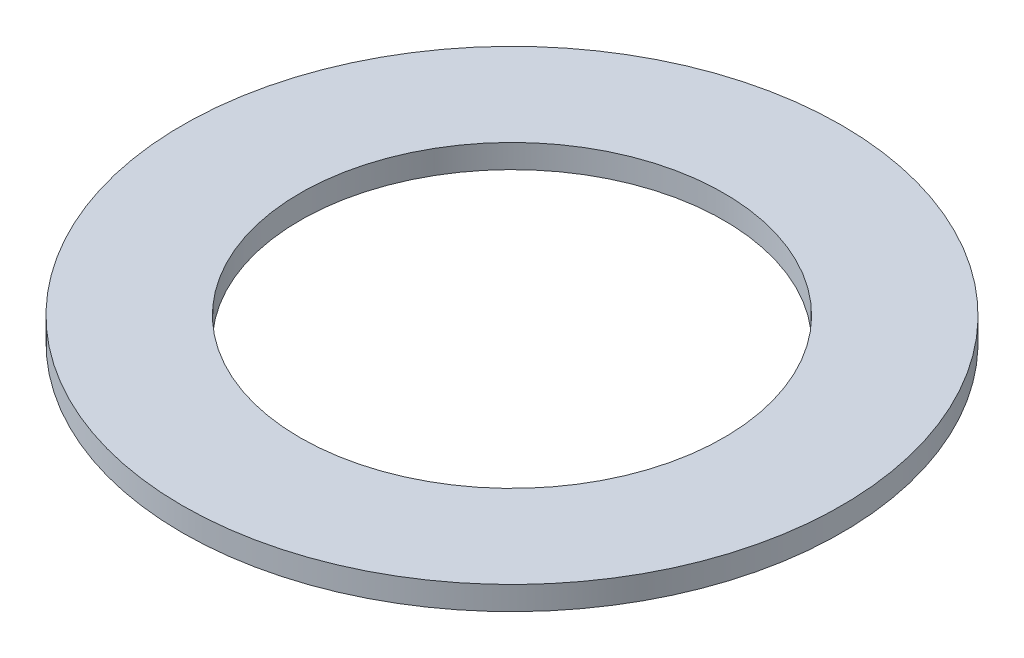
from build123d import *

# Parameters (mm, degrees)
SKETCH1_R           = 70
BOSS_EXTRUDE1_DEPTH = 5
SKETCH2_R           = 45
CUT_EXTRUDE1_DEPTH  = 100.121138008


with BuildPart() as part:
    # Sketch1 → Boss-Extrude1 (new body)
    with BuildSketch(Plane(origin=(0, 0, 0), x_dir=(1, 0, 0), z_dir=(0, 1, 0))):
        Circle(SKETCH1_R)
    extrude(amount=BOSS_EXTRUDE1_DEPTH)

    # Sketch2 → Cut-Extrude1 (cut, through all)
    with BuildSketch(Plane(origin=(0, 0, 0), x_dir=(1, 0, 0), z_dir=(0, 1, 0))):
        Circle(SKETCH2_R)
    extrude(amount=CUT_EXTRUDE1_DEPTH, mode=Mode.SUBTRACT)


solid = part.part
